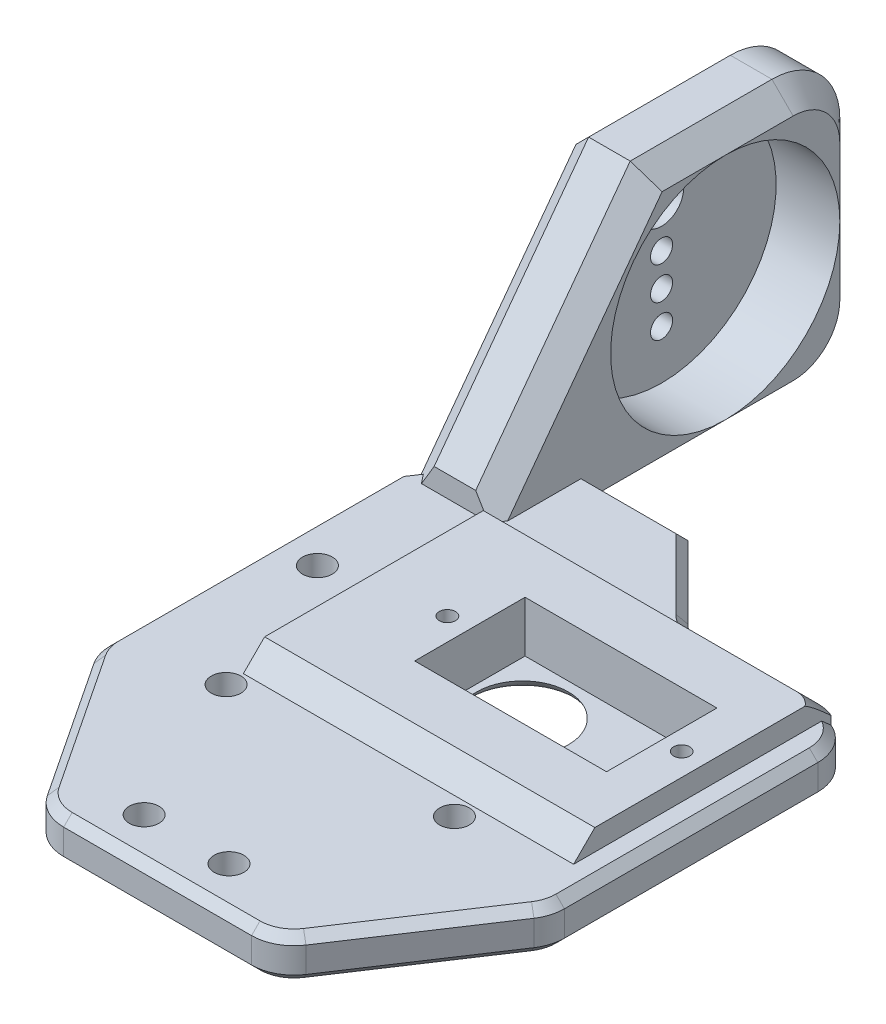
from build123d import *

# Parameters (mm, degrees)
BOSS_EXTRUDE1_DEPTH = 5
SKETCH2_R           = 1.75
SKETCH2_W           = 10.8
SKETCH2_H           = 10.8
CUT_EXTRUDE1_DEPTH  = 61.829127298
FILLET1_R           = 5.4
FILLET2_R           = 5.4
SKETCH3_W           = 35
SKETCH3_H           = 30.758137856
SKETCH3_W_2         = 23
SKETCH3_H_2         = 13
BOSS_EXTRUDE2_DEPTH = 2.5
SKETCH4_W           = 23
SKETCH4_H           = 13
CUT_EXTRUDE2_DEPTH  = 3.5
FILLET4_R           = 4
SKETCH6_W           = 10.398489886
SKETCH6_H           = 32
BOSS_EXTRUDE3_DEPTH = 32
FILLET5_R           = 8
BOSS_EXTRUDE4_DEPTH = 10.398489886
CUT_EXTRUDE6_DEPTH  = 87.325055025
SKETCH11_W          = 5.3
SKETCH11_H          = 13
SKETCH11_R          = 0.95
BOSS_EXTRUDE5_DEPTH = 6
BOSS_EXTRUDE6_DEPTH = 7.5
SKETCH13_R          = 0.95
CUT_EXTRUDE7_DEPTH  = 6
SKETCH14_W          = 4.9
SKETCH14_H          = 13
CUT_EXTRUDE8_DEPTH  = 6
FILLET11_R          = 2.5
SKETCH16_R          = 1.75
CUT_EXTRUDE10_DEPTH = 5
CUT_EXTRUDE11_START = 3
SKETCH17_W          = 56.001510114
SKETCH17_H          = 7.5
CUT_EXTRUDE11_DEPTH = 3.7
FILLET13_R          = 5
SKETCH19_R          = 13.5
CUT_EXTRUDE13_DEPTH = 7.5
SKETCH20_R          = 2.6
SKETCH20_R_2        = 1.3
CUT_EXTRUDE14_DEPTH = 2.898489886
CHAMFER1_SIZE       = 2.5
FILLET15_R          = 5
CHAMFER2_SIZE       = 1
CHAMFER3_SIZE       = 3
CHAMFER4_SIZE       = 2.5


# Some blends are built 0.0001 mm under size
with BuildPart() as part:
    # Sketch1 → Boss-Extrude1 (new body)
    with BuildSketch(Plane(origin=(0, 0, 0), x_dir=(1, 0, 0), z_dir=(0, 1, 0))):
        Polygon((45, 15.379068928), (45, -15.379068928), (28.291776387, -40.622441186), (0.791776387, -40.622441186), (-12.257419102, -20.907257393), (-12.257419102, 14.489137187), (-4.998489886, 25.377558814), (11.001510114, 25.377558814), (21, 15.379068928), align=None)
    extrude(amount=BOSS_EXTRUDE1_DEPTH)

    # Sketch2 → Cut-Extrude1 (cut, through all)
    with BuildSketch(Plane(origin=(0, 5, 0), x_dir=(1, 0, 0), z_dir=(0, 1, 0))):
        with Locations(Location((-7.257419102, 0, 0), (0, 0, 270))):
            Circle(SKETCH2_R)
        with Locations((16.9, 0)):
            Rectangle(SKETCH2_W, SKETCH2_H)
    extrude(amount=-CUT_EXTRUDE1_DEPTH, mode=Mode.SUBTRACT)

    # Fillet1
    fillet1_edges = [part.edges().sort_by_distance(p)[0] for p in [
        (11.5, 2.5, 5.4),
        (11.5, 2.5, -5.4),
    ]]
    fillet(fillet1_edges, radius=FILLET1_R - 0.0001)  # a hair under: the kernel refuses the full size

    # Fillet2
    # the kernel refuses this fillet: 5.4 mm, written as the material it adds along each edge
    with BuildSketch(Plane(origin=(22.3, 5, -5.4), x_dir=(0, 0, 1), z_dir=(0, -1, 0)), Plane(origin=(22.3, 5, 5.4), x_dir=(-1, 0, 0), z_dir=(0, -1, 0))) as fillet2_piece_1:
        with BuildLine():
            CenterArc((FILLET2_R, FILLET2_R), FILLET2_R, 180, 90)
            Line((0, FILLET2_R), (0, 0))
            Line((0, 0), (FILLET2_R, 0))
        make_face()
    extrude(amount=5)
    # the kernel refuses this fillet: 5.4 mm, written as the material it takes off along each edge

    # Sketch3 → Boss-Extrude2 (add)
    with BuildSketch(Plane(origin=(0, 5, 0), x_dir=(1, 0, 0), z_dir=(0, 1, 0))):
        with Locations((16.9, 0)):
            Rectangle(SKETCH3_W, SKETCH3_H)
        with Locations((16.9, 0)):
            Rectangle(SKETCH3_W_2, SKETCH3_H_2, mode=Mode.SUBTRACT)
    extrude(amount=BOSS_EXTRUDE2_DEPTH)

    # Sketch4 → Cut-Extrude2 (cut)
    with BuildSketch(Plane(origin=(0, 5, 0), x_dir=(1, 0, 0), z_dir=(0, 1, 0))):
        with Locations((16.9, 0)):
            Rectangle(SKETCH4_W, SKETCH4_H)
    extrude(amount=-CUT_EXTRUDE2_DEPTH, mode=Mode.SUBTRACT)

    # Fillet4
    fillet4_edges = [part.edges().sort_by_distance(p)[0] for p in [
        (34.4, 6.25, 15.379068928),
        (34.4, 6.25, -15.379068928),
    ]]
    fillet(fillet4_edges, radius=FILLET4_R)

    # Sketch6 → Boss-Extrude3 (add)
    with BuildSketch(Plane(origin=(0, 0, -25.377558814), x_dir=(-1, 0, 0), z_dir=(0, 0, -1))):
        with Locations((5.799244943, 16)):
            Rectangle(SKETCH6_W, SKETCH6_H)
    extrude(amount=BOSS_EXTRUDE3_DEPTH)

    # Fillet5
    fillet5_edges = [part.edges().sort_by_distance(p)[0] for p in [
        (-5.799244943, 0, -57.377558814),
        (-5.799244943, 32, -57.377558814),
    ]]
    fillet(fillet5_edges, radius=FILLET5_R)

    # Sketch8 → Boss-Extrude4 (add)
    with BuildSketch(Plane.ZY.offset(10.998489886)):
        Polygon((-25.377558814, 32), (-25.377558814, 0), (-14.489137187, 0), (-14.489137187, 7.5), align=None)
    extrude(amount=-BOSS_EXTRUDE4_DEPTH)

    # Sketch10 → Cut-Extrude6 (cut, through all)
    with BuildSketch(Plane.ZY.offset(10.998489886)):
        Polygon((-14.489137187, 7.5), (-32.685123921, 32), (-25.377558814, 32), align=None)
    extrude(amount=-CUT_EXTRUDE6_DEPTH, mode=Mode.SUBTRACT)

    # Sketch11 → Boss-Extrude5 (add)
    with BuildSketch(Plane(origin=(0, 1.5, 0), x_dir=(1, 0, 0), z_dir=(0, 1, 0))):
        with Locations((8.05, 0)):
            Rectangle(SKETCH11_W, SKETCH11_H)
        with Locations(Location((8.05, 0, 0), (0, 0, 90))):
            Circle(SKETCH11_R, mode=Mode.SUBTRACT)
    extrude(amount=BOSS_EXTRUDE5_DEPTH)

    # Sketch12 → Boss-Extrude6 (add)
    with BuildSketch(Plane(origin=(0, 7.5, 0), x_dir=(1, 0, 0), z_dir=(0, 1, 0))):
        with BuildLine():
            Line((30.4, 15.379068928), (38.3, 15.379068928))
            Line((38.3, 15.379068928), (38.3, -15.379068928))
            Line((38.3, -15.379068928), (30.4, -15.379068928))
            ThreePointArc((30.4, -15.379068928), (33.228427125, -14.207496053), (34.4, -11.379068928))
            Line((34.4, -11.379068928), (34.4, 11.379068928))
            ThreePointArc((34.4, 11.379068928), (33.228427125, 14.207496053), (30.4, 15.379068928))
        make_face()
    extrude(amount=-BOSS_EXTRUDE6_DEPTH)

    # Sketch13 → Cut-Extrude7 (cut)
    with BuildSketch(Plane(origin=(0, 7.5, 0), x_dir=(1, 0, 0), z_dir=(0, 1, 0))):
        with Locations(Location((35.65, 0, 0), (0, 0, 270))):
            Circle(SKETCH13_R)
    extrude(amount=-CUT_EXTRUDE7_DEPTH, mode=Mode.SUBTRACT)

    # Sketch14 → Cut-Extrude8 (cut)
    with BuildSketch(Plane(origin=(0, 7.5, 0), x_dir=(1, 0, 0), z_dir=(0, 1, 0))):
        with Locations((30.85, 0)):
            Rectangle(SKETCH14_W, SKETCH14_H)
    extrude(amount=-CUT_EXTRUDE8_DEPTH, mode=Mode.SUBTRACT)

    # Fillet11
    # the kernel refuses this fillet: 2.5 mm, written as the material it takes off along each edge
    with BuildSketch(Plane(origin=(11.5, 0, -0.0001), x_dir=(-1, 0, 0), z_dir=(0, 0, 1))) as fillet11_piece_1:
        with BuildLine():
            CenterArc((2.291287847, -2.5), FILLET11_R, 90, 66.421821522)
            Line((0, -1.5), (-0.045825757, -1.48))
            ThreePointArc((-0.045825757, -1.48), (-0.05, -0.75), (-0.05, 0))
            Line((-0.05, 0), (0, 0.05))
            Line((0, 0.05), (2.291287847, 0.05))
            Line((2.291287847, 0.05), (2.291287847, 0))
        make_face()
    extrude(amount=0.0002, mode=Mode.SUBTRACT)
    with BuildSketch(Plane(origin=(16.9, 0, 0), x_dir=(0, 0, -1), z_dir=(-1, 0, 0))) as fillet11_piece_2:
        with BuildLine():
            CenterArc((7.691287847, -2.5), FILLET11_R, 90, 66.421821522)
            Line((5.4, -1.5), (5.354174243, -1.48))
            ThreePointArc((5.354174243, -1.48), (5.35, -0.75), (5.35, 0))
            Line((5.35, 0), (5.4, 0.05))
            Line((5.4, 0.05), (7.691287847, 0.05))
            Line((7.691287847, 0.05), (7.691287847, 0))
        make_face()
    revolve(axis=Axis((16.9, 0, 0), (0, -1, 0)), revolution_arc=180, mode=Mode.SUBTRACT)
    with BuildSketch(Plane(origin=(16.9, 0, -5.4), x_dir=(0, 0, -1), z_dir=(-1, 0, 0)), Plane(origin=(16.8999, 0, 5.4), x_dir=(0, 0, 1), z_dir=(1, 0, 0))) as fillet11_piece_3:
        with BuildLine():
            CenterArc((2.291287847, -2.5), FILLET11_R, 90, 66.421821522)
            Line((0, -1.5), (-0.045825757, -1.48))
            ThreePointArc((-0.045825757, -1.48), (-0.05, -0.75), (-0.05, 0))
            Line((-0.05, 0), (0, 0.05))
            Line((0, 0.05), (2.291287847, 0.05))
            Line((2.291287847, 0.05), (2.291287847, 0))
        make_face()
    extrude(amount=0.0001, mode=Mode.SUBTRACT)
    with BuildSketch(Plane(origin=(16.8999, 0, 0.0001), x_dir=(0, 0, 1), z_dir=(1, 0, 0))) as fillet11_piece_4:
        with BuildLine():
            CenterArc((7.691187847, -2.5), FILLET11_R, 90, 66.421821522)
            Line((5.3999, -1.5), (5.354074243, -1.48))
            ThreePointArc((5.354074243, -1.48), (5.3499, -0.75), (5.3499, 0))
            Line((5.3499, 0), (5.3999, 0.05))
            Line((5.3999, 0.05), (7.691187847, 0.05))
            Line((7.691187847, 0.05), (7.691187847, 0))
        make_face()
    revolve(axis=Axis((16.8999, 0, 0.0001), (0, -1, 0)), revolution_arc=90, mode=Mode.SUBTRACT)
    with BuildSketch(Plane(origin=(16.8999, 0, -0.0001), x_dir=(-1, 0, 0), z_dir=(0, 0, 1))) as fillet11_piece_5:
        with BuildLine():
            CenterArc((7.691187847, -2.5), FILLET11_R, 90, 66.421821522)
            Line((5.3999, -1.5), (5.354074243, -1.48))
            ThreePointArc((5.354074243, -1.48), (5.3499, -0.75), (5.3499, 0))
            Line((5.3499, 0), (5.3999, 0.05))
            Line((5.3999, 0.05), (7.691187847, 0.05))
            Line((7.691187847, 0.05), (7.691187847, 0))
        make_face()
    revolve(axis=Axis((16.8999, 0, -0.0001), (0, -1, 0)), revolution_arc=90, mode=Mode.SUBTRACT)

    # Sketch16 → Cut-Extrude10 (cut)
    with BuildSketch(Plane.XZ):
        with Locations(Location((26.402429287, 17.51658097, 0), (0, 0, 270))):
            Circle(SKETCH16_R)
        with Locations(Location((-0.497570713, 17.51658097, 0), (0, 0, 270))):
            Circle(SKETCH16_R)
        with Locations(Location((7.952429287, 35.622441186, 0), (0, 0, 270))):
            Circle(SKETCH16_R)
        with Locations(Location((17.952429287, 35.622441186, 0), (0, 0, 270))):
            Circle(SKETCH16_R)
    extrude(amount=-CUT_EXTRUDE10_DEPTH, mode=Mode.SUBTRACT)

    # Sketch17 → Cut-Extrude11 (cut)
    with BuildSketch(Plane(origin=(38.3, 0, 0), x_dir=(0, 0, -1), z_dir=(1, 0, 0)).offset(CUT_EXTRUDE11_START)):
        with Locations((-12.621686129, 3.75)):
            Rectangle(SKETCH17_W, SKETCH17_H)
    extrude(amount=CUT_EXTRUDE11_DEPTH, mode=Mode.SUBTRACT)

    # Fillet13
    fillet13_edges = [part.edges().sort_by_distance(p)[0] for p in [
        (41.3, 2.5, 20.969159145),
        (41.3, 2.5, -15.379068928),
    ]]
    fillet(fillet13_edges, radius=FILLET13_R)

    # Sketch19 → Cut-Extrude13 (cut)
    with BuildSketch(Plane(origin=(-0.6, 0, 0), x_dir=(0, 0, -1), z_dir=(1, 0, 0))):
        with Locations(Location((41.377558814, 16, 0), (0, 0, 90))):
            Circle(SKETCH19_R)
    extrude(amount=-CUT_EXTRUDE13_DEPTH, mode=Mode.SUBTRACT)

    # Sketch20 → Cut-Extrude14 (cut)
    with BuildSketch(Plane(origin=(-8.1, 0, 0), x_dir=(0, 0, -1), z_dir=(1, 0, 0))):
        with Locations(Location((41.377558814, 21.1, 0), (0, 0, 90))):
            Circle(SKETCH20_R)
        with Locations(Location((41.377558814, 16, 0), (0, 0, 90))):
            Circle(SKETCH20_R_2)
        with Locations(Location((41.377558814, 12.14, 0), (0, 0, 90))):
            Circle(SKETCH20_R_2)
        with Locations(Location((41.377558814, 8.28, 0), (0, 0, 90))):
            Circle(SKETCH20_R_2)
    extrude(amount=-CUT_EXTRUDE14_DEPTH, mode=Mode.SUBTRACT)

    # Chamfer1
    # the kernel refuses this chamfer: 2.5 mm, written as the material it takes off along each edge
    with BuildSketch(Plane(origin=(36.3, 7.5, -10.379068928), x_dir=(0, 0, -1), z_dir=(-1, 0, 0))) as chamfer1_piece_1:
        Polygon((5, CHAMFER1_SIZE), (5 - CHAMFER1_SIZE, 0), (5, 0), align=None)
    revolve(axis=Axis((36.3, 7.5, -10.379068928), (0, -1, 0)), revolution_arc=97.253499891, mode=Mode.SUBTRACT)
    with BuildSketch(Plane(origin=(-0.6, 7.5, -15.379068928), x_dir=(0, -0.9996219169112968, -0.027495876610583555), z_dir=(1, 0, 0))) as chamfer1_piece_2_section:
        Polygon((CHAMFER1_SIZE * 0.999621916911, -CHAMFER1_SIZE * 0.0274958766106), (-CHAMFER1_SIZE * 0.0274958766106, -CHAMFER1_SIZE * 0.999621916911), (0, 0), align=None)
    chamfer1_piece_2 = extrude(amount=36.9, mode=Mode.PRIVATE)
    chamfer1_piece_2 = split(chamfer1_piece_2, bisect_by=Plane(origin=(16.232757692, 6.687775213, -20.146311237), z_dir=(-0.7071067811865488, 0, 0.7071067811865462)), keep=Keep.TOP, mode=Mode.PRIVATE)
    chamfer1_piece_2 = split(chamfer1_piece_2, bisect_by=Plane(origin=(10.621838461, 5, -14.535392006), z_dir=(0, 1, 0)), keep=Keep.TOP, mode=Mode.PRIVATE)
    add(chamfer1_piece_2, mode=Mode.SUBTRACT)
    with BuildSketch(Plane(origin=(-0.6, 7.5, -15.379068928), x_dir=(0, -0.9996219169112968, -0.027495876610583555), z_dir=(1, 0, 0))) as chamfer1_piece_3_section:
        Polygon((CHAMFER1_SIZE * 0.999621916911, -CHAMFER1_SIZE * 0.0274958766106), (-CHAMFER1_SIZE * 0.0274958766106, -CHAMFER1_SIZE * 0.999621916911), (0, 0), align=None)
    chamfer1_piece_3 = extrude(amount=36.9, mode=Mode.PRIVATE)
    chamfer1_piece_3 = split(chamfer1_piece_3, bisect_by=Plane(origin=(25.423978381, 6.663910151, -10.955090548), z_dir=(0.7071067811865488, 0, -0.7071067811865462)), keep=Keep.TOP, mode=Mode.PRIVATE)
    chamfer1_piece_3 = split(chamfer1_piece_3, bisect_by=Plane(origin=(29.049318921, 5, -14.580431087), z_dir=(0, 1, 0)), keep=Keep.TOP, mode=Mode.PRIVATE)
    add(chamfer1_piece_3, mode=Mode.SUBTRACT)
    with BuildSketch(Plane(origin=(-7.02920747, 7.5, 15.379068928), x_dir=(0, 0.027495876610586317, -0.9996219169112968), z_dir=(1, 0, 0))) as chamfer1_piece_4_section:
        Polygon((CHAMFER1_SIZE * 0.999621916911, -CHAMFER1_SIZE * 0.0274958766106), (-CHAMFER1_SIZE * 0.0274958766106, -CHAMFER1_SIZE * 0.999621916911), (0, 0), align=None)
    chamfer1_piece_4 = extrude(amount=51.75841494, mode=Mode.PRIVATE)
    chamfer1_piece_4 = split(chamfer1_piece_4, bisect_by=Plane(origin=(18.85, 5, 14.553058543), z_dir=(0, 1, 0)), keep=Keep.TOP, mode=Mode.PRIVATE)
    add(chamfer1_piece_4, mode=Mode.SUBTRACT)

    # Fillet15
    fillet15_edges = [part.edges().sort_by_distance(p)[0] for p in [
        (21, 2.5, -15.379068928),
        (28.291776387, 2.5, 40.622441186),
        (0.791776387, 2.5, 40.622441186),
        (-12.257419102, 2.5, 20.907257393),
    ]]
    fillet(fillet15_edges, radius=FILLET15_R)

    # Chamfer2
    # the kernel refuses this chamfer: 1 mm, written as the material it takes off along each edge
    with BuildSketch(Plane(origin=(-12.257419102, 0, 19.402428197), x_dir=(0.9996219169112968, -0.02749587661058639, 0), z_dir=(0, 0, -1))) as chamfer2_piece_1:
        Polygon((CHAMFER2_SIZE * 0.999621916911, -CHAMFER2_SIZE * 0.0274958766106), (-CHAMFER2_SIZE * 0.0274958766106, -CHAMFER2_SIZE * 0.999621916911), (0, 0), align=None)
    extrude(amount=36.463248372, mode=Mode.SUBTRACT)
    with BuildSketch(Plane(origin=(-13.683929638, 5, -12.349365919), x_dir=(0.8317363636871494, 0.02749587661058643, 0.5544894932186661), z_dir=(0.5546992156114058, 0, -0.8320509480795579))) as chamfer2_piece_2_section:
        Polygon((CHAMFER2_SIZE * 0.999621916911, CHAMFER2_SIZE * 0.0274958766106), (-CHAMFER2_SIZE * 0.0274958766106, CHAMFER2_SIZE * 0.999621916911), (0, 0), align=None)
    chamfer2_piece_2 = extrude(amount=7.412936908, mode=Mode.PRIVATE)
    chamfer2_piece_2 = split(chamfer2_piece_2, bisect_by=Plane(origin=(-10.998489886, 4.666666667, -14.832410235), z_dir=(-1, 0, 0)), keep=Keep.TOP, mode=Mode.PRIVATE)
    add(chamfer2_piece_2, mode=Mode.SUBTRACT)
    with BuildSketch(Plane(origin=(41.3, 5, -10.379068928), x_dir=(-0.9996219169112968, 0.027495876610586414, 0), z_dir=(0, 0, 1)), Plane(origin=(41.3, 0, 19.464329949), x_dir=(-0.9996219169112968, -0.027495876610586292, 0), z_dir=(0, 0, -1))) as chamfer2_piece_3:
        Polygon((CHAMFER2_SIZE * 0.999621916911, CHAMFER2_SIZE * 0.0274958766106), (-CHAMFER2_SIZE * 0.0274958766106, CHAMFER2_SIZE * 0.999621916911), (0, 0), align=None)
    extrude(amount=29.843398877, mode=Mode.SUBTRACT)
    with BuildSketch(Plane(origin=(-0.6, 5, -25.377558814), x_dir=(0, 0.02749587661058651, 0.9996219169112968), z_dir=(1, 0, 0))) as chamfer2_piece_4:
        Polygon((CHAMFER2_SIZE * 0.999621916911, CHAMFER2_SIZE * 0.0274958766106), (-CHAMFER2_SIZE * 0.0274958766106, CHAMFER2_SIZE * 0.999621916911), (0, 0), align=None)
    extrude(amount=14.173193102, mode=Mode.SUBTRACT)
    with BuildSketch(Plane(origin=(36.3, 5, -10.379068928), x_dir=(0.399999999999997, 0, -0.9165151389911692), z_dir=(-0.9165151389911692, 0, -0.399999999999997))) as chamfer2_piece_5_section:
        Polygon((5 - CHAMFER2_SIZE, 0), (5, CHAMFER2_SIZE), (5, 0), align=None)
    chamfer2_piece_5 = revolve(axis=Axis((36.3, 5, -10.379068928), (0, -1, 0)), revolution_arc=66.421821522, mode=Mode.PRIVATE)
    chamfer2_piece_5 = split(chamfer2_piece_5, bisect_by=Plane(origin=(38.3, 4.658198802, -12.75423459), z_dir=(1, 0, 0)), keep=Keep.TOP, mode=Mode.PRIVATE)
    add(chamfer2_piece_5, mode=Mode.SUBTRACT)
    with BuildSketch(Plane(origin=(36.3, 5, 19.464329949), x_dir=(1, 0, 0), z_dir=(0, 0, -1))) as chamfer2_piece_6:
        Polygon((5 - CHAMFER2_SIZE, 0), (5, CHAMFER2_SIZE), (5, 0), align=None)
    revolve(axis=Axis((36.3, 5, 19.464329949), (0, -1, 0)), revolution_arc=33.5, mode=Mode.SUBTRACT)
    with BuildSketch(Plane(origin=(23.071067812, 0, -15.379068928), x_dir=(0, -0.027495876610586462, 0.9996219169112968), z_dir=(1, 0, 0))) as chamfer2_piece_7:
        Polygon((CHAMFER2_SIZE * 0.999621916911, -CHAMFER2_SIZE * 0.0274958766106), (-CHAMFER2_SIZE * 0.0274958766106, -CHAMFER2_SIZE * 0.999621916911), (0, 0), align=None)
    extrude(amount=13.228932188, mode=Mode.SUBTRACT)
    with BuildSketch(Plane(origin=(36.3, 0, -10.379068928), x_dir=(0, 0, -1), z_dir=(-1, 0, 0))) as chamfer2_piece_8:
        Polygon((5 - CHAMFER2_SIZE, 0), (5, -CHAMFER2_SIZE), (5, 0), align=None)
    revolve(axis=Axis((36.3, 0, -10.379068928), (0, -1, 0)), revolution_arc=90, mode=Mode.SUBTRACT)
    with BuildSketch(Plane(origin=(36.3, 0, 19.464329949), x_dir=(1, 0, 0), z_dir=(0, 0, -1))) as chamfer2_piece_9:
        Polygon((5 - CHAMFER2_SIZE, 0), (5, -CHAMFER2_SIZE), (5, 0), align=None)
    revolve(axis=Axis((36.3, 0, 19.464329949), (0, -1, 0)), revolution_arc=33.5, mode=Mode.SUBTRACT)
    with BuildSketch(Plane(origin=(-0.691055813, 0, 38.382126112), x_dir=(0.8335705439399325, -0.02749587661058642, -0.5517283072718858), z_dir=(-0.5519369853120623, 0, -0.8338858220671655))) as chamfer2_piece_10:
        Polygon((CHAMFER2_SIZE * 0.999621916911, -CHAMFER2_SIZE * 0.0274958766106), (-CHAMFER2_SIZE * 0.0274958766106, -CHAMFER2_SIZE * 0.999621916911), (0, 0), align=None)
    extrude(amount=19.451119757, mode=Mode.SUBTRACT)
    with BuildSketch(Plane(origin=(-0.691055813, 5, 38.382126112), x_dir=(0.8335705439399325, 0.027495876610586528, -0.5517283072718858), z_dir=(-0.5519369853120623, 0, -0.8338858220671655))) as chamfer2_piece_11:
        Polygon((CHAMFER2_SIZE * 0.999621916911, CHAMFER2_SIZE * 0.0274958766106), (-CHAMFER2_SIZE * 0.0274958766106, CHAMFER2_SIZE * 0.999621916911), (0, 0), align=None)
    extrude(amount=19.451119757, mode=Mode.SUBTRACT)
    with BuildSketch(Plane(origin=(40.46942911, 0, 22.224014876), x_dir=(-0.8335705439399328, -0.02749587661058634, -0.5517283072718857), z_dir=(-0.551936985312062, 0, 0.8338858220671658))) as chamfer2_piece_12:
        Polygon((CHAMFER2_SIZE * 0.999621916911, -CHAMFER2_SIZE * 0.0274958766106), (-CHAMFER2_SIZE * 0.0274958766106, -CHAMFER2_SIZE * 0.999621916911), (0, 0), align=None)
    extrude(amount=19.37688687, mode=Mode.SUBTRACT)
    with BuildSketch(Plane(origin=(25.605179476, 0, 40.622441186), x_dir=(0, -0.027495876610586292, -0.9996219169112968), z_dir=(-1, 0, 0))) as chamfer2_piece_13:
        Polygon((CHAMFER2_SIZE * 0.999621916911, -CHAMFER2_SIZE * 0.0274958766106), (-CHAMFER2_SIZE * 0.0274958766106, -CHAMFER2_SIZE * 0.999621916911), (0, 0), align=None)
    extrude(amount=22.126806179, mode=Mode.SUBTRACT)
    with BuildSketch(Plane(origin=(9.183055634, 0, -27.196013294), x_dir=(-0.7068394360706748, -0.02749587661058635, 0.7068394360706722), z_dir=(0.7071067811865462, 0, 0.7071067811865488))) as chamfer2_piece_14:
        Polygon((CHAMFER2_SIZE * 0.999621916911, -CHAMFER2_SIZE * 0.0274958766106), (-CHAMFER2_SIZE * 0.0274958766106, -CHAMFER2_SIZE * 0.999621916911), (0, 0), align=None)
    extrude(amount=14.640615176, mode=Mode.SUBTRACT)
    with BuildSketch(Plane(origin=(25.605179476, 0, 35.622441186), x_dir=(0, 0, 1), z_dir=(-1, 0, 0))) as chamfer2_piece_15:
        Polygon((5 - CHAMFER2_SIZE, 0), (5, CHAMFER2_SIZE), (5, 0), align=None)
    revolve(axis=Axis((25.605179476, 0, 35.622441186), (0, 1, 0)), revolution_arc=56.5, mode=Mode.SUBTRACT)
    with BuildSketch(Plane(origin=(3.478373298, 0, 35.622441186), x_dir=(-0.8338858220671655, 0, 0.5519369853120621), z_dir=(-0.5519369853120621, 0, -0.8338858220671655))) as chamfer2_piece_16:
        Polygon((5 - CHAMFER2_SIZE, 0), (5, CHAMFER2_SIZE), (5, 0), align=None)
    revolve(axis=Axis((3.478373298, 0, 35.622441186), (0, 1, 0)), revolution_arc=56.5, mode=Mode.SUBTRACT)
    with BuildSketch(Plane(origin=(-7.257419102, 0, 19.402428197), x_dir=(-1, 0, 0), z_dir=(0, 0, -1))) as chamfer2_piece_17:
        Polygon((5 - CHAMFER2_SIZE, 0), (5, CHAMFER2_SIZE), (5, 0), align=None)
    revolve(axis=Axis((-7.257419102, 0, 19.402428197), (0, 1, 0)), revolution_arc=33.5, mode=Mode.SUBTRACT)
    with BuildSketch(Plane(origin=(40.46942911, 5, 22.224014876), x_dir=(-0.8335705439399328, 0.027495876610586462, -0.5517283072718857), z_dir=(-0.551936985312062, 0, 0.8338858220671658))) as chamfer2_piece_18:
        Polygon((CHAMFER2_SIZE * 0.999621916911, CHAMFER2_SIZE * 0.0274958766106), (-CHAMFER2_SIZE * 0.0274958766106, CHAMFER2_SIZE * 0.999621916911), (0, 0), align=None)
    extrude(amount=19.37688687, mode=Mode.SUBTRACT)
    with BuildSketch(Plane(origin=(25.605179476, 5, 40.622441186), x_dir=(0, 0.027495876610586414, -0.9996219169112968), z_dir=(-1, 0, 0))) as chamfer2_piece_19:
        Polygon((CHAMFER2_SIZE * 0.999621916911, CHAMFER2_SIZE * 0.0274958766106), (-CHAMFER2_SIZE * 0.0274958766106, CHAMFER2_SIZE * 0.999621916911), (0, 0), align=None)
    extrude(amount=22.126806179, mode=Mode.SUBTRACT)
    with BuildSketch(Plane(origin=(25.605179476, 5, 35.622441186), x_dir=(0, 0, 1), z_dir=(-1, 0, 0))) as chamfer2_piece_20:
        Polygon((5 - CHAMFER2_SIZE, 0), (5, -CHAMFER2_SIZE), (5, 0), align=None)
    revolve(axis=Axis((25.605179476, 5, 35.622441186), (0, 1, 0)), revolution_arc=56.5, mode=Mode.SUBTRACT)
    with BuildSketch(Plane(origin=(3.478373298, 5, 35.622441186), x_dir=(-0.8338858220671655, 0, 0.5519369853120621), z_dir=(-0.5519369853120621, 0, -0.8338858220671655))) as chamfer2_piece_21:
        Polygon((5 - CHAMFER2_SIZE, 0), (5, -CHAMFER2_SIZE), (5, 0), align=None)
    revolve(axis=Axis((3.478373298, 5, 35.622441186), (0, 1, 0)), revolution_arc=56.5, mode=Mode.SUBTRACT)
    with BuildSketch(Plane(origin=(-7.257419102, 5, 19.402428197), x_dir=(-1, 0, 0), z_dir=(0, 0, -1))) as chamfer2_piece_22:
        Polygon((5 - CHAMFER2_SIZE, 0), (5, -CHAMFER2_SIZE), (5, 0), align=None)
    revolve(axis=Axis((-7.257419102, 5, 19.402428197), (0, 1, 0)), revolution_arc=33.5, mode=Mode.SUBTRACT)
    with BuildSketch(Plane(origin=(9.183055634, 5, -27.196013294), x_dir=(-0.7068394360706747, 0.02749587661058652, 0.7068394360706721), z_dir=(0.7071067811865462, 0, 0.7071067811865488))) as chamfer2_piece_23:
        Polygon((CHAMFER2_SIZE * 0.999621916911, CHAMFER2_SIZE * 0.0274958766106), (-CHAMFER2_SIZE * 0.0274958766106, CHAMFER2_SIZE * 0.999621916911), (0, 0), align=None)
    extrude(amount=14.640615176, mode=Mode.SUBTRACT)
    with BuildSketch(Plane(origin=(23.071067812, 0, -20.379068928), x_dir=(-0.707106781186549, 0, 0.7071067811865461), z_dir=(-0.7071067811865461, 0, -0.707106781186549))) as chamfer2_piece_24:
        Polygon((5 + CHAMFER2_SIZE, 0), (5, CHAMFER2_SIZE), (5, 0), align=None)
    revolve(axis=Axis((23.071067812, 0, -20.379068928), (0, 1, 0)), revolution_arc=45, mode=Mode.SUBTRACT)
    with BuildSketch(Plane(origin=(23.071067812, 5, -20.379068928), x_dir=(-0.707106781186549, 0, 0.7071067811865461), z_dir=(-0.7071067811865461, 0, -0.707106781186549))) as chamfer2_piece_25_section:
        Polygon((5 + CHAMFER2_SIZE, 0), (5, -CHAMFER2_SIZE), (5, 0), align=None)
    chamfer2_piece_25 = revolve(axis=Axis((23.071067812, 5, -20.379068928), (0, 1, 0)), revolution_arc=45, mode=Mode.PRIVATE)
    chamfer2_piece_25 = split(chamfer2_piece_25, bisect_by=Plane(origin=(19.787008854, 4.71049628, -15.379068928), z_dir=(0, 0, -1)), keep=Keep.TOP, mode=Mode.PRIVATE)
    add(chamfer2_piece_25, mode=Mode.SUBTRACT)
    with BuildSketch(Plane(origin=(-12.257419102, 5, 19.402428197), x_dir=(0.9996219169112968, 0.02749587661058651, 0), z_dir=(0, 0, -1))) as chamfer2_piece_26:
        Polygon((CHAMFER2_SIZE * 0.999621916911, CHAMFER2_SIZE * 0.0274958766106), (-CHAMFER2_SIZE * 0.0274958766106, CHAMFER2_SIZE * 0.999621916911), (0, 0), align=None)
    extrude(amount=36.463248372, mode=Mode.SUBTRACT)
    with BuildSketch(Plane(origin=(-0.6, 0, -25.377558814), x_dir=(0, -0.02749587661058639, 0.9996219169112968), z_dir=(1, 0, 0))) as chamfer2_piece_27:
        Polygon((CHAMFER2_SIZE * 0.999621916911, -CHAMFER2_SIZE * 0.0274958766106), (-CHAMFER2_SIZE * 0.0274958766106, -CHAMFER2_SIZE * 0.999621916911), (0, 0), align=None)
    extrude(amount=14.173193102, mode=Mode.SUBTRACT)

    # Chamfer3
    chamfer3_edges = [part.edges().sort_by_distance(p)[0] for p in [
        (-10.998489886, 0, -32.877547323),
        (-10.998489886, 2.343145751, -55.034413064),
        (-10.998489886, 16, -57.377558814),
        (-10.998489886, 29.656854249, -55.034413064),
        (-10.998489886, 19.75, -23.587130554),
        (-10.998489886, 32, -41.031341368),
    ]]
    chamfer(chamfer3_edges, length=CHAMFER3_SIZE)

    # Chamfer4
    # the kernel refuses this chamfer: 2.5 mm, written as the material it takes off along each edge
    with BuildSketch(Plane(origin=(-0.6, 0, -49.377558814), x_dir=(-0.9996219169112968, -0.02749587661058568, 0), z_dir=(0, 0, 1))) as chamfer4_piece_1_section:
        Polygon((CHAMFER4_SIZE * 0.999621916911, -CHAMFER4_SIZE * 0.0274958766106), (-CHAMFER4_SIZE * 0.0274958766106, -CHAMFER4_SIZE * 0.999621916911), (0, 0), align=None)
    chamfer4_piece_1 = extrude(amount=31.42920747, mode=Mode.PRIVATE)
    chamfer4_piece_1 = split(chamfer4_piece_1, bisect_by=Plane(origin=(-1.428663626, 0.816501917, -25.377558814), z_dir=(0, 0, -1)), keep=Keep.TOP, mode=Mode.PRIVATE)
    chamfer4_piece_1 = split(chamfer4_piece_1, bisect_by=Plane(origin=(-1.428663626, 6.955354075, -31.33291289), z_dir=(0, -0.7071067811862649, -0.7071067811868302)), keep=Keep.TOP, mode=Mode.PRIVATE)
    add(chamfer4_piece_1, mode=Mode.SUBTRACT)
    with BuildSketch(Plane(origin=(-0.6, 0, -49.377558814), x_dir=(-0.9996219169112968, -0.02749587661058568, 0), z_dir=(0, 0, 1))) as chamfer4_piece_2_section:
        Polygon((CHAMFER4_SIZE * 0.999621916911, -CHAMFER4_SIZE * 0.0274958766106), (-CHAMFER4_SIZE * 0.0274958766106, -CHAMFER4_SIZE * 0.999621916911), (0, 0), align=None)
    chamfer4_piece_2 = extrude(amount=31.42920747, mode=Mode.PRIVATE)
    chamfer4_piece_2 = split(chamfer4_piece_2, bisect_by=Plane(origin=(-0.909994456, 1.807059888, -25.377558814), z_dir=(0, 0, -1)), keep=Keep.TOP, mode=Mode.PRIVATE)
    chamfer4_piece_2 = split(chamfer4_piece_2, bisect_by=Plane(origin=(-0.909994456, 1.605294916, -25.982853731), z_dir=(0, 0.7071067811862649, 0.7071067811868302)), keep=Keep.TOP, mode=Mode.PRIVATE)
    add(chamfer4_piece_2, mode=Mode.SUBTRACT)
    with BuildSketch(Plane(origin=(-0.6, 0, -49.377558814), x_dir=(-0.9996219169112968, -0.02749587661058568, 0), z_dir=(0, 0, 1))) as chamfer4_piece_3_section:
        Polygon((CHAMFER4_SIZE * 0.999621916911, -CHAMFER4_SIZE * 0.0274958766106), (-CHAMFER4_SIZE * 0.0274958766106, -CHAMFER4_SIZE * 0.999621916911), (0, 0), align=None)
    chamfer4_piece_3 = extrude(amount=31.42920747, mode=Mode.PRIVATE)
    chamfer4_piece_3 = split(chamfer4_piece_3, bisect_by=Plane(origin=(-1.729917323, 0.263748406, -25.377558814), z_dir=(0, 0, 1)), keep=Keep.TOP, mode=Mode.PRIVATE)
    chamfer4_piece_3 = split(chamfer4_piece_3, bisect_by=Plane(origin=(-1.729917323, 0.447811305, -24.825370119), z_dir=(0, -0.7071067811862649, -0.7071067811868302)), keep=Keep.TOP, mode=Mode.PRIVATE)
    add(chamfer4_piece_3, mode=Mode.SUBTRACT)
    with BuildSketch(Plane(origin=(-0.6, 8, -49.377558814), x_dir=(0, -1, 0), z_dir=(0, 0, 1))) as chamfer4_piece_4:
        Polygon((8 - CHAMFER4_SIZE, 0), (8, -CHAMFER4_SIZE), (8, 0), align=None)
    revolve(axis=Axis((-0.6, 8, -49.377558814), (1, 0, 0)), revolution_arc=90, mode=Mode.SUBTRACT)
    with BuildSketch(Plane(origin=(-0.6, 24, -57.377558814), x_dir=(-0.9996219169112968, 0, -0.0274958766105877), z_dir=(0, -1, 0))) as chamfer4_piece_5:
        Polygon((CHAMFER4_SIZE * 0.999621916911, -CHAMFER4_SIZE * 0.0274958766106), (-CHAMFER4_SIZE * 0.0274958766106, -CHAMFER4_SIZE * 0.999621916911), (0, 0), align=None)
    extrude(amount=16, mode=Mode.SUBTRACT)
    with BuildSketch(Plane(origin=(-0.6, 24, -49.377558814), x_dir=(0, 1, 0), z_dir=(0, 0, 1))) as chamfer4_piece_6:
        Polygon((8, CHAMFER4_SIZE), (8 - CHAMFER4_SIZE, 0), (8, 0), align=None)
    revolve(axis=Axis((-0.6, 24, -49.377558814), (-1, 0, 0)), revolution_arc=90, mode=Mode.SUBTRACT)
    with BuildSketch(Plane(origin=(-0.6, 32, -26.255916451), x_dir=(-0.9996219169112968, 0.0274958766105877, 0), z_dir=(0, 0, -1))) as chamfer4_piece_7:
        Polygon((CHAMFER4_SIZE * 0.999621916911, -CHAMFER4_SIZE * 0.0274958766106), (-CHAMFER4_SIZE * 0.0274958766106, -CHAMFER4_SIZE * 0.999621916911), (0, 0), align=None)
    extrude(amount=23.121642363, mode=Mode.SUBTRACT)
    with BuildSketch(Plane(origin=(-0.6, 2.33858856, -10.655791306), x_dir=(-0.9996219169112968, 0.01639412102361097, 0.022073876561396404), z_dir=(0, 0.8028067944157775, -0.5962392563726944))) as chamfer4_piece_8_section:
        Polygon((CHAMFER4_SIZE * 0.999621916911, -CHAMFER4_SIZE * 0.0274958766106), (-CHAMFER4_SIZE * 0.0274958766106, -CHAMFER4_SIZE * 0.999621916911), (0, 0), align=None)
    chamfer4_piece_8 = extrude(amount=43.376343002, mode=Mode.PRIVATE)
    chamfer4_piece_8 = split(chamfer4_piece_8, bisect_by=Plane(origin=(-1.42372546, 7.959665442, -12.419403487), z_dir=(0, 0.7071067811868302, -0.7071067811862648)), keep=Keep.TOP, mode=Mode.PRIVATE)
    chamfer4_piece_8 = split(chamfer4_piece_8, bisect_by=Plane(origin=(-1.42372546, 5, -25.7882417), z_dir=(0, 1, 0)), keep=Keep.TOP, mode=Mode.PRIVATE)
    add(chamfer4_piece_8, mode=Mode.SUBTRACT)


solid = part.part
